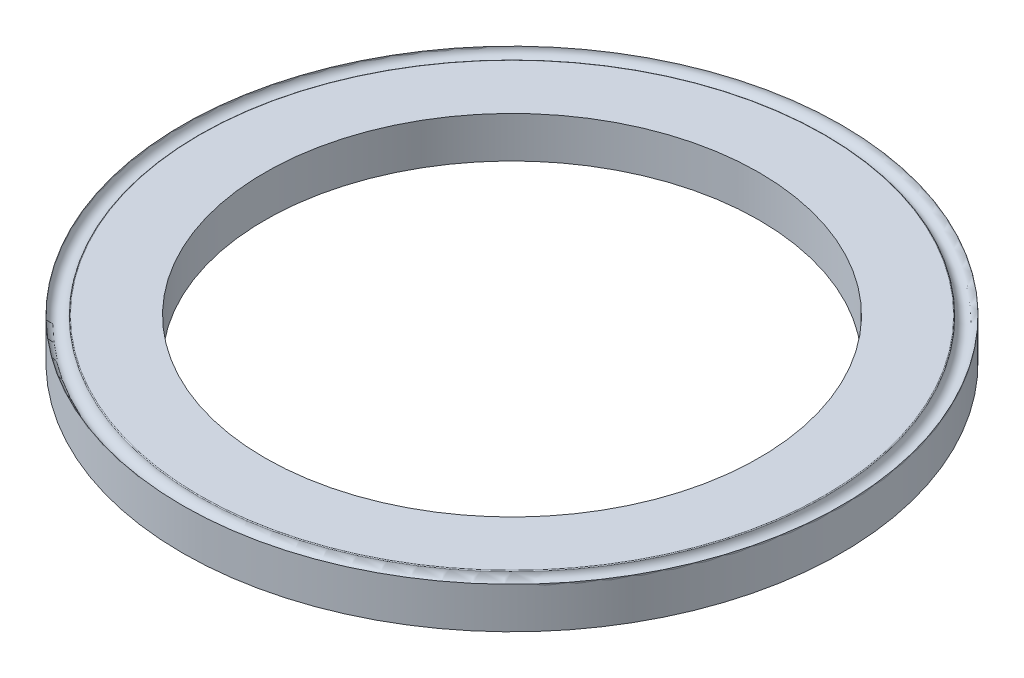
from build123d import *

# Parameters (mm, degrees)
TOP_SKETCH_R   = 4
TOP_SKETCH_R_2 = 3
TOP_DEPTH      = 0.25


with BuildPart() as part:
    # Top Sketch → Top (new, symmetric)
    with BuildSketch(Plane(origin=(0, 0, 0), x_dir=(1, 0, 0), z_dir=(0, 1, 0))):
        Circle(TOP_SKETCH_R)
        Circle(TOP_SKETCH_R_2, mode=Mode.SUBTRACT)
    extrude(amount=TOP_DEPTH, both=True)

    # Crimp Sketch → Crimp (revolve, cut)
    with BuildSketch(Plane.XY):
        with BuildLine():
            Line((-4, 0.25), (-3.790455488, 0.25))
            ThreePointArc((-3.790455488, 0.25), (-3.797197487, 0.247385489), (-3.80041408, 0.240909091))
            ThreePointArc((-3.80041408, 0.240909091), (-3.904550167, 0.150103574), (-4, 0.25))
        make_face()
    revolve(axis=Axis((0, 0.25, 0), (0, -1, 0)), mode=Mode.SUBTRACT)


solid = part.part
